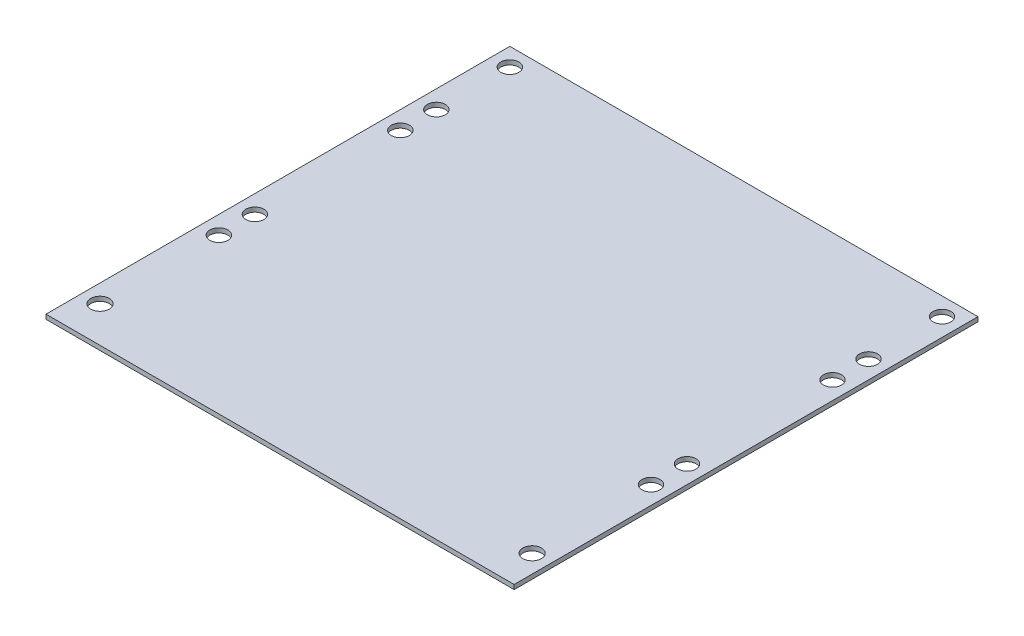
from build123d import *

# Parameters (mm, degrees)
SKETCH1_W           = 165.1
SKETCH1_H           = 163.576
SKETCH1_R           = 3.2639
SKETCH1_R_2         = 3.175
BOSS_EXTRUDE1_DEPTH = 1.5875


with BuildPart() as part:
    # Sketch1 → Boss-Extrude1 (new body)
    with BuildSketch(Plane(origin=(0, 0, 0), x_dir=(1, 0, 0), z_dir=(0, 1, 0))):
        with Locations((82.55, 81.788)):
            Rectangle(SKETCH1_W, SKETCH1_H)
        with Locations((6.35, 12.7)):
            Circle(SKETCH1_R, mode=Mode.SUBTRACT)
        with Locations((6.35, 54.61)):
            Circle(SKETCH1_R_2, mode=Mode.SUBTRACT)
        with Locations((6.35, 67.31)):
            Circle(SKETCH1_R_2, mode=Mode.SUBTRACT)
        with Locations((6.35, 118.618)):
            Circle(SKETCH1_R_2, mode=Mode.SUBTRACT)
        with Locations((6.35, 131.318)):
            Circle(SKETCH1_R_2, mode=Mode.SUBTRACT)
        with Locations((6.35, 157.226)):
            Circle(SKETCH1_R_2, mode=Mode.SUBTRACT)
        with Locations((158.75, 12.7)):
            Circle(SKETCH1_R, mode=Mode.SUBTRACT)
        with Locations((158.75, 54.61)):
            Circle(SKETCH1_R_2, mode=Mode.SUBTRACT)
        with Locations((158.75, 67.31)):
            Circle(SKETCH1_R_2, mode=Mode.SUBTRACT)
        with Locations((158.75, 118.618)):
            Circle(SKETCH1_R_2, mode=Mode.SUBTRACT)
        with Locations((158.75, 131.318)):
            Circle(SKETCH1_R_2, mode=Mode.SUBTRACT)
        with Locations((158.75, 157.226)):
            Circle(SKETCH1_R_2, mode=Mode.SUBTRACT)
    extrude(amount=BOSS_EXTRUDE1_DEPTH)


solid = part.part
